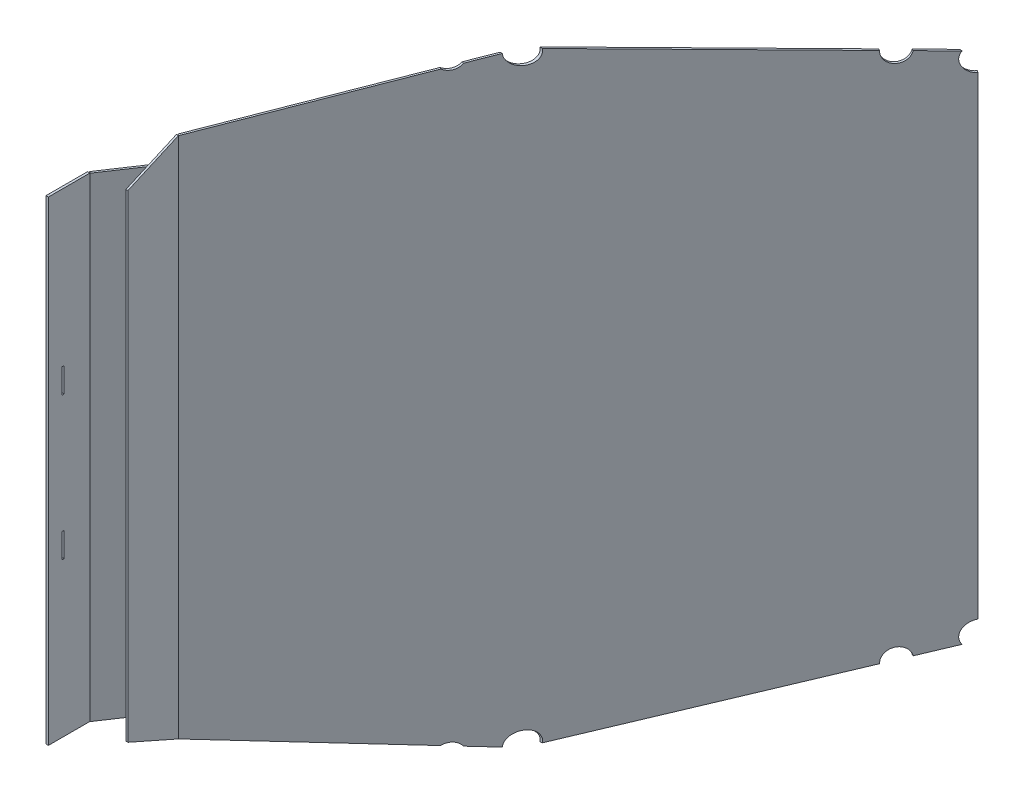
from build123d import *

# Parameters (mm, degrees)
BOSS_EXTRUDE1_DEPTH = 2.159
BOSS_EXTRUDE2_DEPTH = 2.159
SKETCH5_R           = 12.954
CUT_EXTRUDE1_DEPTH  = 621.665
SKETCH6_R           = 12.954
CUT_EXTRUDE2_DEPTH  = 1057.425179982
SKETCH7_R           = 12.954
CUT_EXTRUDE3_DEPTH  = 1057.425179982
SKETCH8_R           = 12.954
CUT_EXTRUDE4_DEPTH  = 1172.774112298
SKETCH10_W          = 44.45
SKETCH10_H          = 508
SKETCH10_W_2        = 2.546199611
SKETCH10_H_2        = 26.284614443
BOSS_EXTRUDE3_DEPTH = 2.54


with BuildPart() as part:
    # Sketch3 → Boss-Extrude1 (new body)
    with BuildSketch(Plane(origin=(251.476706106, 0, 168.307390472), x_dir=(-0.5562007015720102, 0, 0.8310480007621723), z_dir=(-0.8310480007621723, 0, -0.5562007015720102))):
        Polygon((-187.204535341, 0), (-187.204535341, -273.05), (164.402521358, -323.85), (429.299541391, -279.4), (429.299541391, -254), (497.262516096, -254), (497.262516096, 254), (429.299541391, 254), (429.299541391, 279.4), (164.402521358, 323.85), (-187.204535341, 273.05), align=None)
    extrude(amount=BOSS_EXTRUDE1_DEPTH)

    # Sketch5 → Cut-Extrude1 (cut)
    with BuildSketch(Plane(origin=(825.5, 177.8, 47.625), x_dir=(-0.07152915299803123, 0.013455979276857365, 0.9973477412081931), z_dir=(-0.9801553180651386, 0.18438565389344194, -0.07278381074741123))):
        Circle(SKETCH5_R)
    cut_extrude1 = extrude(amount=CUT_EXTRUDE1_DEPTH, mode=Mode.SUBTRACT)

    # Sketch6 → Cut-Extrude2 (cut, through all)
    with BuildSketch(Plane(origin=(825.5, 227.0125, 304.8), x_dir=(-0.42445842434756254, 0.047278784890198794, 0.9042122331066369), z_dir=(-0.8986546712744607, 0.1000976737805711, -0.4270834081304366))):
        Circle(SKETCH6_R)
    cut_extrude2 = extrude(amount=CUT_EXTRUDE2_DEPTH, mode=Mode.SUBTRACT)

    # Sketch7 → Cut-Extrude3 (cut, through all)
    with BuildSketch(Plane(origin=(825.5, 227.0125, 304.8), x_dir=(-0.00023887502122916035, 3.372792217408492e-05, 0.9999999709005754), z_dir=(-0.9901785863890273, 0.13980811442036903, -0.00024124437506688719))):
        Circle(SKETCH7_R)
    cut_extrude3 = extrude(amount=CUT_EXTRUDE3_DEPTH, mode=Mode.SUBTRACT)

    # Sketch8 → Cut-Extrude4 (cut, through all)
    with BuildSketch(Plane(origin=(825.5, 220.292352851, 603.464669867), x_dir=(-0.3334143845379491, 0.04979061934850228, 0.9414646793205114), z_dir=(-0.9311392123382828, 0.13905218320513943, -0.33711163965654883))):
        Circle(SKETCH8_R)
    cut_extrude4 = extrude(amount=CUT_EXTRUDE4_DEPTH, mode=Mode.SUBTRACT)

    # Mirror1: Cut-Extrude1, Cut-Extrude2, Cut-Extrude3, Cut-Extrude4 across plane
    add(cut_extrude1.mirror(Plane.ZX), mode=Mode.SUBTRACT)
    add(cut_extrude2.mirror(Plane.ZX), mode=Mode.SUBTRACT)
    add(cut_extrude3.mirror(Plane.ZX), mode=Mode.SUBTRACT)
    add(cut_extrude4.mirror(Plane.ZX), mode=Mode.SUBTRACT)


with BuildPart() as body_2:
    # Sketch4 → Boss-Extrude2 (new body)
    with BuildSketch(Plane.ZY.offset(-12.7)):
        Polygon((525.075916073, 279.4), (525.075916073, -279.4), (579.050916073, -255.529861723), (579.050916073, 255.529861723), align=None)
    extrude(amount=BOSS_EXTRUDE2_DEPTH)


with BuildPart() as body_3:
    # Sketch10 → Boss-Extrude3 (new body)
    with BuildSketch(Plane(origin=(-25.4, 0, 0), x_dir=(0, 0, -1), z_dir=(1, 0, 0))):
        with Locations((-603.781410327, 0)):
            Rectangle(SKETCH10_W, SKETCH10_H)
        with Locations((-610.405741924, 76.257111933)):
            Rectangle(SKETCH10_W_2, SKETCH10_H_2, mode=Mode.SUBTRACT)
        with Locations((-610.405741924, -76.257111933)):
            Rectangle(SKETCH10_W_2, SKETCH10_H_2, mode=Mode.SUBTRACT)
    extrude(amount=-BOSS_EXTRUDE3_DEPTH)


solid = Compound([part.part, body_2.part, body_3.part])
